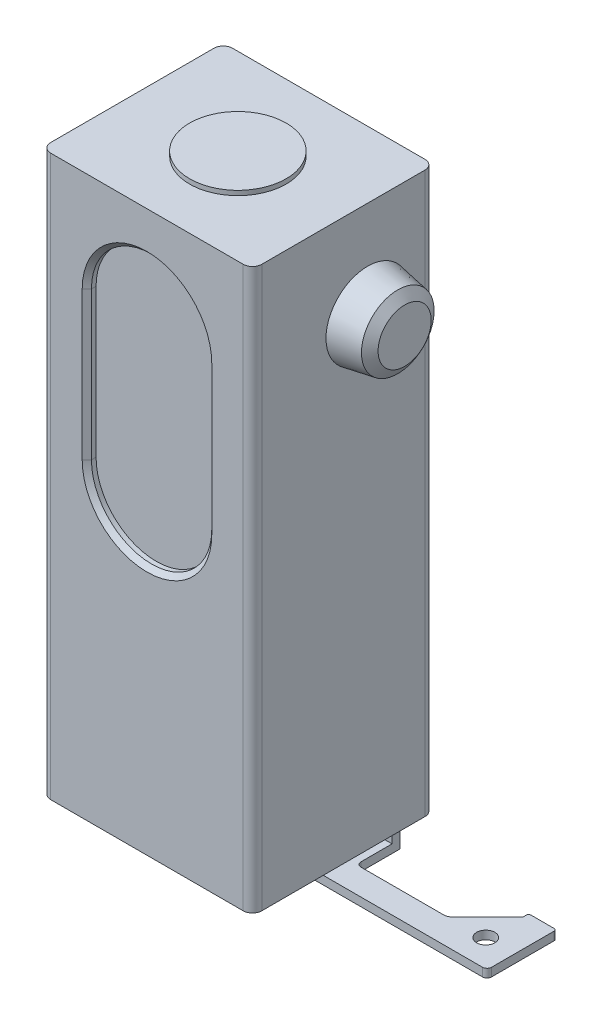
from build123d import *

# Parameters (mm, degrees)
SKETCH1_W                     = 57.912
SKETCH1_H                     = 49.8856
BOSS_EXTRUDE1_DEPTH           = 153.67
SHELL2_T                      = -2.54
SKETCH2_W                     = 52.832
SKETCH2_H                     = 44.8056
BOSS_EXTRUDE2_DEPTH           = 2.54
CUT_EXTRUDE1_REACH            = 166.139
BOSS_EXTRUDE3_DEPTH           = 2.54
SKETCH5_W                     = 34.7472
SKETCH5_H                     = 111.0742
BOSS_EXTRUDE4_DEPTH           = 2.1336
SKETCH6_R                     = 4.5212
BOSS_EXTRUDE5_DEPTH           = 9.2456
FILLET1_R                     = 1.27
CHAMFER1_SIZE                 = 0.762
FILLET2_R                     = 2.54
BOSS_EXTRUDE6_DEPTH           = 2.3114
CUT_EXTRUDE2_REACH            = 185.571
SKETCH8_R                     = 2.5
SKETCH9_R                     = 13.25
BOSS_EXTRUDE7_DEPTH           = 1.27
SKETCH10_R                    = 11.43
BOSS_EXTRUDE8_DEPTH           = 10.16
BOSS_EXTRUDE8_TAPER           = 10
SKETCH11_R                    = 11.43
BOSS_EXTRUDE9_DEPTH           = 6.096
BOSS_EXTRUDE9_DRAFT           = 10
BOSS_EXTRUDE9_PROFILE_2_DEPTH = 6.096
BOSS_EXTRUDE9_PROFILE_2_DRAFT = 10
CHAMFER2_SIZE                 = 1.905
CHAMFER2_SIZE_2               = 2.348489814
CHAMFER3_SIZE                 = 1.27


with BuildPart() as part:
    # Sketch1 → Boss-Extrude1 (new body)
    with BuildSketch(Plane(origin=(0, 0, 0), x_dir=(1, 0, 0), z_dir=(0, 1, 0))):
        Rectangle(SKETCH1_W, SKETCH1_H)
    extrude(amount=BOSS_EXTRUDE1_DEPTH)

    # Shell2
    shell2_openings = [part.faces().sort_by_distance(p)[0] for p in [
        (0, 153.67, 0),
    ]]
    offset(amount=SHELL2_T, openings=shell2_openings, kind=Kind.INTERSECTION)

    # Sketch2 → Boss-Extrude2 (add)
    with BuildSketch(Plane(origin=(0, 153.67, 0), x_dir=(1, 0, 0), z_dir=(0, 1, 0))):
        Rectangle(SKETCH2_W, SKETCH2_H)
    extrude(amount=-BOSS_EXTRUDE2_DEPTH)

    # Sketch3 → Cut-Extrude1 (cut, up to next)
    with BuildSketch(Plane.XY.offset(24.9428), mode=Mode.PRIVATE) as cut_extrude1_sk1:
        with BuildLine():
            Line((-16.51, 85.09), (-16.51, 125.73))
            ThreePointArc((-16.51, 125.73), (0, 142.24), (16.51, 125.73))
            Line((16.51, 125.73), (16.51, 85.09))
            ThreePointArc((16.51, 85.09), (0, 68.58), (-16.51, 85.09))
        make_face()
    cut_extrude1_tool1 = extrude(cut_extrude1_sk1.sketch, amount=-CUT_EXTRUDE1_REACH, mode=Mode.PRIVATE) & part.part
    add(cut_extrude1_tool1.solids().sort_by_distance((0, 105.41, 24.9428))[0], mode=Mode.SUBTRACT)

    # Sketch4 → Boss-Extrude3 (add)
    with BuildSketch(Plane(origin=(0, 0, 22.4028), x_dir=(-1, 0, 0), z_dir=(0, 0, -1))):
        with BuildLine():
            Line((19.05, 85.09), (19.05, 125.73))
            ThreePointArc((19.05, 125.73), (0, 144.78), (-19.05, 125.73))
            Line((-19.05, 125.73), (-19.05, 85.09))
            ThreePointArc((-19.05, 85.09), (0, 66.04), (19.05, 85.09))
        make_face()
    extrude(amount=BOSS_EXTRUDE3_DEPTH)

    # Sketch5 → Boss-Extrude4 (add)
    with BuildSketch(Plane(origin=(0, 0, -24.9428), x_dir=(-1, 0, 0), z_dir=(0, 0, -1))):
        with Locations((0, 41.9989)):
            Rectangle(SKETCH5_W, SKETCH5_H)
    extrude(amount=BOSS_EXTRUDE4_DEPTH)

    # Sketch6 → Boss-Extrude5 (add)
    with BuildSketch(Plane(origin=(0, 0, -27.0764), x_dir=(-1, 0, 0), z_dir=(0, 0, -1))):
        with Locations(Location((-11.0236, 91.186, 0), (0, 0, 180))):
            Circle(SKETCH6_R)
        with Locations(Location((-11.0236, 78.486, 0), (0, 0, 180))):
            Circle(SKETCH6_R)
        with Locations(Location((11.0236, 91.186, 0), (0, 0, 180))):
            Circle(SKETCH6_R)
        with Locations(Location((11.0236, 78.486, 0), (0, 0, 180))):
            Circle(SKETCH6_R)
    extrude(amount=BOSS_EXTRUDE5_DEPTH)

    # Fillet1
    fillet1_edges = [part.edges().sort_by_distance(p)[0] for p in [
        (6.5024, 91.186, -36.322),
        (6.5024, 78.486, -36.322),
        (-15.5448, 91.186, -36.322),
        (-15.5448, 78.486, -36.322),
    ]]
    fillet(fillet1_edges, radius=FILLET1_R)

    # Chamfer1
    chamfer1_edges = [part.edges().sort_by_distance(p)[0] for p in [
        (6.5024, 91.186, -27.0764),
        (6.5024, 78.486, -27.0764),
        (-15.5448, 91.186, -27.0764),
        (-15.5448, 78.486, -27.0764),
    ]]
    chamfer(chamfer1_edges, length=CHAMFER1_SIZE)

    # Fillet2
    fillet2_edges = [part.edges().sort_by_distance(p)[0] for p in [
        (28.956, 76.835, 24.9428),
        (-28.956, 76.835, 24.9428),
        (-28.956, 76.835, -24.9428),
        (28.956, 76.835, -24.9428),
    ]]
    fillet(fillet2_edges, radius=FILLET2_R)

    # Sketch7 → Boss-Extrude6 (add)
    with BuildSketch(Plane.XZ.offset(13.5382)):
        with BuildLine():
            Line((1.27, -8.0264), (59.0804, -8.0264))
            ThreePointArc((59.0804, -8.0264), (59.978425612, -8.398374388), (60.3504, -9.2964))
            Line((60.3504, -9.2964), (60.3504, -26.4414))
            ThreePointArc((60.3504, -26.4414), (60.164412806, -26.890412806), (59.7154, -27.0764))
            Line((59.7154, -27.0764), (53.3654, -27.0764))
            ThreePointArc((53.3654, -27.0764), (52.916387194, -26.890412806), (52.7304, -26.4414))
            Line((52.7304, -26.4414), (52.7304, -25.779323164))
            ThreePointArc((52.7304, -25.779323164), (52.682063503, -25.536319184), (52.544412806, -25.330310358))
            Line((52.544412806, -25.330310358), (43.096451224, -15.882348776))
            ThreePointArc((43.096451224, -15.882348776), (42.272415918, -15.331745987), (41.3004, -15.1384))
            Line((41.3004, -15.1384), (18.6436, -15.1384))
            ThreePointArc((18.6436, -15.1384), (17.745574388, -15.510374388), (17.3736, -16.4084))
            Line((17.3736, -16.4084), (17.3736, -27.0764))
            Line((17.3736, -27.0764), (-17.3736, -27.0764))
            Line((-17.3736, -27.0764), (-17.3736, -16.4084))
            ThreePointArc((-17.3736, -16.4084), (-17.745574388, -15.510374388), (-18.6436, -15.1384))
            Line((-18.6436, -15.1384), (-41.3004, -15.1384))
            ThreePointArc((-41.3004, -15.1384), (-42.272415918, -15.331745987), (-43.096451224, -15.882348776))
            Line((-43.096451224, -15.882348776), (-52.544412806, -25.330310358))
            ThreePointArc((-52.544412806, -25.330310358), (-52.682063503, -25.536319184), (-52.7304, -25.779323164))
            Line((-52.7304, -25.779323164), (-52.7304, -26.4414))
            ThreePointArc((-52.7304, -26.4414), (-52.916387194, -26.890412806), (-53.3654, -27.0764))
            Line((-53.3654, -27.0764), (-59.7154, -27.0764))
            ThreePointArc((-59.7154, -27.0764), (-60.164412806, -26.890412806), (-60.3504, -26.4414))
            Line((-60.3504, -26.4414), (-60.3504, -9.2964))
            ThreePointArc((-60.3504, -9.2964), (-59.978425612, -8.398374388), (-59.0804, -8.0264))
            Line((-59.0804, -8.0264), (-1.27, -8.0264))
            ThreePointArc((-1.27, -8.0264), (-0.371974388, -8.398374388), (0, -9.2964))
            ThreePointArc((0, -9.2964), (0.371974388, -8.398374388), (1.27, -8.0264))
        make_face()
    extrude(amount=BOSS_EXTRUDE6_DEPTH)

    # Sketch8 → Cut-Extrude2 (cut, up to next)
    with BuildSketch(Plane.XZ.offset(15.8496), mode=Mode.PRIVATE) as cut_extrude2_sk1:
        with Locations(Location((-52.5, -15.5264, 0), (0, 0, 270))):
            Circle(SKETCH8_R)
    cut_extrude2_tool1 = extrude(cut_extrude2_sk1.sketch, amount=-CUT_EXTRUDE2_REACH, mode=Mode.PRIVATE) & part.part
    # Sketch8 → Cut-Extrude2 (cut, up to next)
    with BuildSketch(Plane.XZ.offset(15.8496), mode=Mode.PRIVATE) as cut_extrude2_sk2:
        with Locations(Location((52.5, -15.5264, 0), (0, 0, 270))):
            Circle(SKETCH8_R)
    cut_extrude2_tool2 = extrude(cut_extrude2_sk2.sketch, amount=-CUT_EXTRUDE2_REACH, mode=Mode.PRIVATE) & part.part
    add(cut_extrude2_tool1.solids().sort_by_distance((-52.5, -15.8496, -15.5264))[0], mode=Mode.SUBTRACT)
    add(cut_extrude2_tool2.solids().sort_by_distance((52.5, -15.8496, -15.5264))[0], mode=Mode.SUBTRACT)

    # Sketch9 → Boss-Extrude7 (add)
    with BuildSketch(Plane(origin=(0, 153.67, 0), x_dir=(1, 0, 0), z_dir=(0, 1, 0))):
        with Locations(Location((0, 0, 0), (0, 0, 90))):
            Circle(SKETCH9_R)
    extrude(amount=BOSS_EXTRUDE7_DEPTH)

    # Sketch10 → Boss-Extrude8 (add)
    with BuildSketch(Plane(origin=(28.956, 0, 0), x_dir=(0, 0, -1), z_dir=(1, 0, 0))):
        with Locations((6.6548, 127.254)):
            Circle(SKETCH10_R)
    extrude(amount=BOSS_EXTRUDE8_DEPTH, taper=BOSS_EXTRUDE8_TAPER)


with BuildPart() as boss_extrude9_tool:
    # Sketch11 → Boss-Extrude9 (with draft: the straight prism first)
    with BuildSketch(Plane.ZY.offset(28.956)):
        with Locations((-7.1628, 127.508)):
            Circle(SKETCH11_R)
    extrude(amount=BOSS_EXTRUDE9_DEPTH)
    # Boss-Extrude9: the draft: its side faces are tilted about the plane it starts from
    boss_extrude9_sides = [boss_extrude9_tool.faces().sort_by_distance(p)[0] for p in [
        (-32.004, 127.508, -18.5928),
    ]]
    draft(boss_extrude9_sides, Plane.ZY.offset(28.956), BOSS_EXTRUDE9_DRAFT)


with BuildPart() as part_1:
    add(part.part)

    # Boss-Extrude9: add boss_extrude9_tool
    add(boss_extrude9_tool.part)


with BuildPart() as boss_extrude9_profile_2_tool:
    # Sketch11 → Boss-Extrude9 profile 2 (with draft: the straight prism first)
    with BuildSketch(Plane.ZY.offset(28.956)):
        with Locations((-7.1628, 71.628)):
            Circle(SKETCH11_R)
    extrude(amount=BOSS_EXTRUDE9_PROFILE_2_DEPTH)
    # Boss-Extrude9 profile 2: the draft: its side faces are tilted about the plane it starts from
    boss_extrude9_profile_2_sides = [boss_extrude9_profile_2_tool.faces().sort_by_distance(p)[0] for p in [
        (-32.004, 71.628, -18.5928),
    ]]
    draft(boss_extrude9_profile_2_sides, Plane.ZY.offset(28.956), BOSS_EXTRUDE9_PROFILE_2_DRAFT)


with BuildPart() as part_2:
    add(part_1.part)

    # Boss-Extrude9 profile 2: add boss_extrude9_profile_2_tool
    add(boss_extrude9_profile_2_tool.part)

    # Chamfer2
    # the kernel refuses this chamfer: 2.348489814, 1.905 mm, written as the material it takes off along each edge
    with BuildSketch(Plane(origin=(39.116, 127.254, -6.6548), x_dir=(0, 0, -1), z_dir=(0, 1, 0))) as chamfer2_piece_1:
        Polygon((9.638517876 + CHAMFER2_SIZE * 0.173648177667, CHAMFER2_SIZE * 0.984807753012), (9.638517876 - CHAMFER2_SIZE_2, 0), (9.638517876, 0), align=None)
    revolve(axis=Axis((39.116, 127.254, -6.6548), (-1, 0, 0)), mode=Mode.SUBTRACT)
    with BuildSketch(Plane(origin=(-35.052, 127.508, -7.1628), x_dir=(0, 0, 1), z_dir=(0, -1, 0))) as chamfer2_piece_2:
        Polygon((10.355110726 + CHAMFER2_SIZE * 0.173648177667, -CHAMFER2_SIZE * 0.984807753012), (10.355110726 - CHAMFER2_SIZE_2, 0), (10.355110726, 0), align=None)
    revolve(axis=Axis((-35.052, 127.508, -7.1628), (-1, 0, 0)), mode=Mode.SUBTRACT)
    with BuildSketch(Plane(origin=(-35.052, 71.628, -7.1628), x_dir=(0, 0, 1), z_dir=(0, -1, 0))) as chamfer2_piece_3:
        Polygon((10.355110726 + CHAMFER2_SIZE * 0.173648177667, -CHAMFER2_SIZE * 0.984807753012), (10.355110726 - CHAMFER2_SIZE_2, 0), (10.355110726, 0), align=None)
    revolve(axis=Axis((-35.052, 71.628, -7.1628), (-1, 0, 0)), mode=Mode.SUBTRACT)

    # Chamfer3
    chamfer3_edges = [part_2.edges().sort_by_distance(p)[0] for p in [
        (0, 68.58, 24.9428),
        (16.51, 105.41, 24.9428),
        (0, 142.24, 24.9428),
        (-16.51, 105.41, 24.9428),
    ]]
    chamfer(chamfer3_edges, length=CHAMFER3_SIZE)


solid = part_2.part
